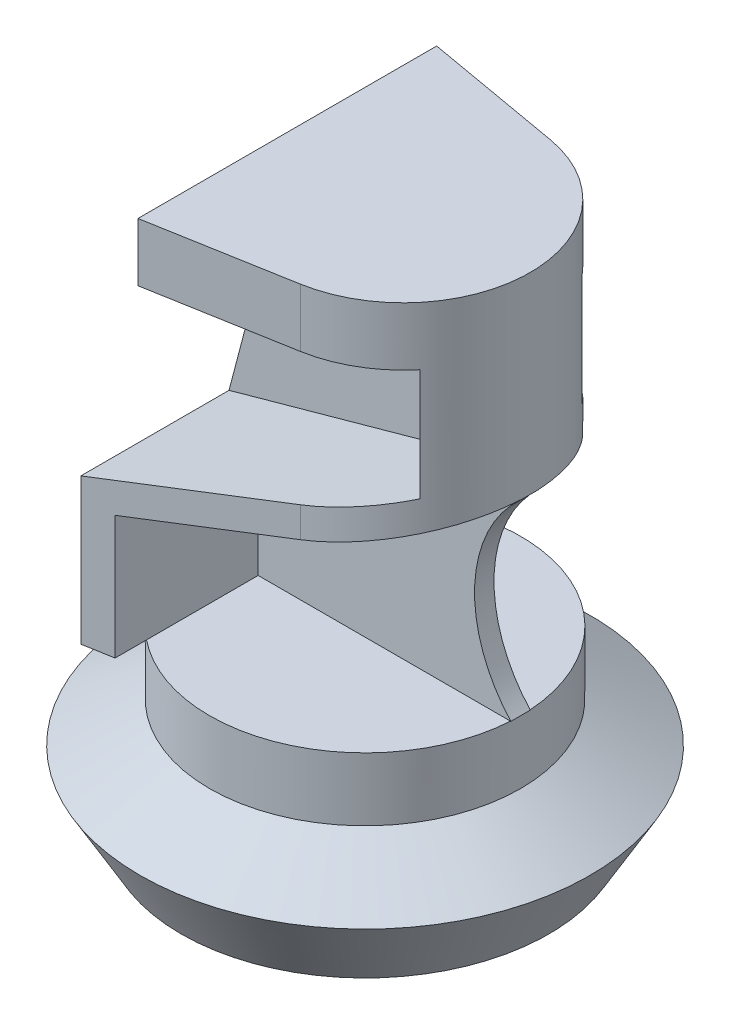
from build123d import *

# Parameters (mm, degrees)
BOSS_EXTRUDE1_DEPTH = 40
RIB7_START          = -2
RIB7_DEPTH          = 4
SKETCH2_OUTSIDE_W   = 129.678
SKETCH2_OUTSIDE_H   = 129.678
CUT_EXTRUDE1_DEPTH  = 80
RIB1_REACH          = 105.413
SKETCH3_WALL_W      = 248.119937824
SKETCH3_WALL_H      = 4


# Read off the part's stored shape, not the designer's step: Rib7
with BuildPart() as part:
    # Sketch1 → Revolve1 (revolve)
    with BuildSketch(Plane.XY, mode=Mode.PRIVATE) as revolve1_sk:
        with BuildLine():
            Line((-37.837168574, -36), (-29.262233414, -31.049258877))
            ThreePointArc((-29.262233414, -31.049258877), (-17.458182667, -17.181874451), (0, -12))
            Line((0, -12), (0, 0))
            Line((0, 0), (-32, 0))
            Line((-32, 0), (-32, -13))
            Line((-32, -13), (-46.337168574, -21.277568136))
            Line((-46.337168574, -21.277568136), (-37.837168574, -36))
        make_face()
    revolve(revolve1_sk.sketch.rotate(Axis((0, 0, 0), (0, -1, 0)), 270), axis=Axis((0, 0, 0), (0, -1, 0)))

    # Sketch1<3> → Boss-Extrude1 (add, symmetric)
    with BuildSketch(Plane.XY):
        Polygon((-26, 0), (-20, 0), (-20, 25.439486103), (34, 40.439486103), (34, 80), (-16, 80), (-16, 68), (28, 68), (28, 45), (-26, 30), align=None)
    extrude(amount=BOSS_EXTRUDE1_DEPTH, both=True)

    # Rib7 outline → Rib7 (add)
    with BuildSketch(Plane.XY.offset(RIB7_START)):
        with BuildLine():
            Line((-20, 0), (32, 0))
            ThreePointArc((32, 0), (24.570511929, 20.636636978), (34, 40.439486103))
            Line((34, 40.439486103), (-20, 25.439486103))
            Line((-20, 25.439486103), (-20, 0))
        make_face()
    extrude(amount=RIB7_DEPTH)

    # Sketch2 outside → Cut-Extrude1 (cut)
    with BuildSketch(Plane(origin=(0, 80, 0), x_dir=(1, 0, 0), z_dir=(0, 1, 0))):
        Rectangle(SKETCH2_OUTSIDE_W, SKETCH2_OUTSIDE_H)
        with BuildLine():
            Line((12.412638687, 25.726815399), (-26, 32.5))
            Line((-26, 32.5), (-26, -32.5))
            Line((-26, -32.5), (12.412638687, -25.726815399))
            ThreePointArc((12.412638687, -25.726815399), (34, 0), (12.412638687, 25.726815399))
        make_face(mode=Mode.SUBTRACT)
    extrude(amount=-CUT_EXTRUDE1_DEPTH, mode=Mode.SUBTRACT)

    # Sketch3 wall → Rib1 (add, up to next)
    with BuildSketch(Plane(origin=(-21, 49, 0), x_dir=(-0.25449329928, -0.967074537263, 0), z_dir=(0.967074537263, -0.25449329928, 0)), mode=Mode.PRIVATE) as rib1_sk1:
        Rectangle(SKETCH3_WALL_W, SKETCH3_WALL_H)
    rib1_tool1 = extrude(rib1_sk1.sketch, amount=RIB1_REACH, mode=Mode.PRIVATE) - part.part
    add(rib1_tool1.solids().sort_by_distance((-21, 49, 0))[0])


solid = part.part
